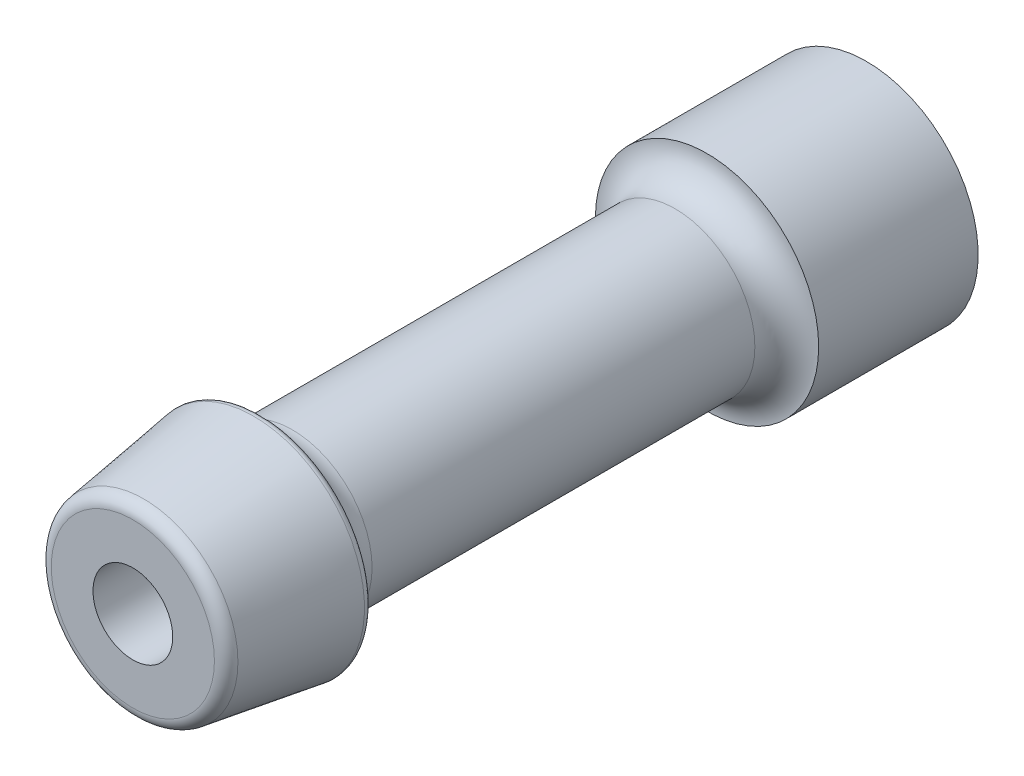
from build123d import *

# Parameters (mm, degrees)
SKETCH1_R           = 4.445
BOSS_EXTRUDE1_DEPTH = 29.21
SKETCH2_R           = 1.5875
CUT_EXTRUDE1_START  = -5.08
SKETCH3_R           = 6.35
SKETCH3_R_2         = 3.175
CUT_EXTRUDE1_DEPTH  = 17.78
FILLET1_R           = 1.27
FILLET2_R           = 1.27
CHAMFER1_SIZE       = 5.08
CHAMFER1_SIZE_2     = 0.759211087
FILLET3_R           = 0.254
FILLET4_R           = 0.508


# Some blends are built 0.0001 mm under size
with BuildPart() as part:
    # Sketch1 → Boss-Extrude1 (new body)
    with BuildSketch(Plane.XY):
        with Locations(Location((0, 0, 0), (0, 0, 180))):
            Circle(SKETCH1_R)
    extrude(amount=BOSS_EXTRUDE1_DEPTH)

    # Cut-Sweep1: sweep along a curve in space
    with BuildLine() as cut_sweep1_path:
        Line((0, 0, 29.21), (0, 0, 0))
    # Sketch2 → Cut-Sweep1 (sweep, cut)
    with BuildSketch(Plane.XY.offset(29.21)):
        Circle(SKETCH2_R)
    sweep(path=cut_sweep1_path.line, mode=Mode.SUBTRACT)

    # Sketch3 → Cut-Extrude1 (cut)
    with BuildSketch(Plane.XY.offset(29.21).offset(CUT_EXTRUDE1_START)):
        Circle(SKETCH3_R)
        Circle(SKETCH3_R_2, mode=Mode.SUBTRACT)
    extrude(amount=-CUT_EXTRUDE1_DEPTH, mode=Mode.SUBTRACT)

    # Fillet1
    fillet1_edges = [part.edges().sort_by_distance(p)[0] for p in [
        (-3.175, 0, 6.35),
    ]]
    fillet(fillet1_edges, radius=FILLET1_R - 0.0001)  # a hair under: the kernel refuses the full size

    # Fillet2
    fillet2_edges = [part.edges().sort_by_distance(p)[0] for p in [
        (-3.175, 0, 24.13),
    ]]
    fillet(fillet2_edges, radius=FILLET2_R - 0.0001)  # a hair under: the kernel refuses the full size

    # Chamfer1
    # the kernel refuses this chamfer: 5.08, 0.759211087 mm, written as the material it takes off along each edge
    with BuildSketch(Plane(origin=(0, 0, 29.21), x_dir=(-1, 0, 0), z_dir=(0, 1, 0))) as chamfer1_piece_1:
        Polygon((4.445, -CHAMFER1_SIZE), (4.445 - CHAMFER1_SIZE_2, 0), (4.445, 0), align=None)
    revolve(axis=Axis((0, 0, 29.21), (0, 0, 1)), mode=Mode.SUBTRACT)

    # Fillet3
    fillet3_edges = [part.edges().sort_by_distance(p)[0] for p in [
        (4.445, 0, 24.13),
    ]]
    fillet(fillet3_edges, radius=FILLET3_R)

    # Fillet4
    fillet4_edges = [part.edges().sort_by_distance(p)[0] for p in [
        (3.685788913, 0, 29.21),
    ]]
    fillet(fillet4_edges, radius=FILLET4_R)


solid = part.part
